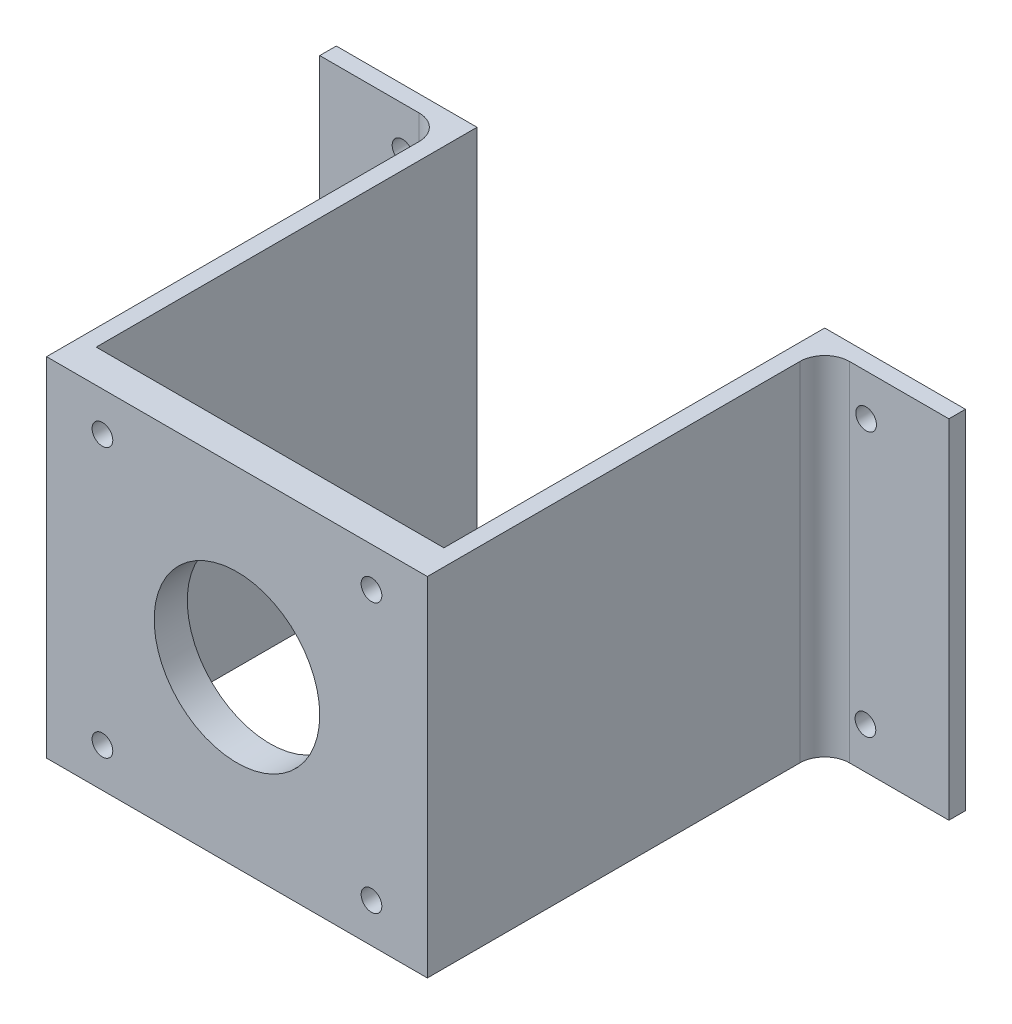
from build123d import *

# Parameters (mm, degrees)
CROQUIS1_W              = 46
CROQUIS1_H              = 42
SALIENTE_EXTRUIR1_DEPTH = 4
CROQUIS3_W              = 2
CROQUIS3_H              = 42
SALIENTE_EXTRUIR2_DEPTH = 46
CROQUIS4_W              = 2
CROQUIS4_H              = 42
SALIENTE_EXTRUIR3_DEPTH = 15
CROQUIS6_W              = 2
CROQUIS6_H              = 42
SALIENTE_EXTRUIR4_DEPTH = 15
CROQUIS8_R              = 1.25
CORTAR_EXTRUIR1_DEPTH   = 15
CROQUIS7_R              = 1.25
CORTAR_EXTRUIR2_DEPTH   = 15
CROQUIS10_R             = 1.25
CORTAR_EXTRUIR4_DEPTH   = 15
REDONDEO1_R             = 3
REDONDEO2_R             = 3
CROQUIS11_R             = 10
CORTAR_EXTRUIR5_DEPTH   = 15


with BuildPart() as part:
    # Croquis1 → Saliente-Extruir1 (new body)
    with BuildSketch(Plane.XY):
        with Locations((-61.749794594, 15.620374367)):
            Rectangle(CROQUIS1_W, CROQUIS1_H)
    extrude(amount=SALIENTE_EXTRUIR1_DEPTH)

    # Croquis3 → Saliente-Extruir2 (add)
    with BuildSketch(Plane(origin=(0, 0, 0), x_dir=(-1, 0, 0), z_dir=(0, 0, -1))):
        with Locations((83.749794594, 15.620374367)):
            Rectangle(CROQUIS3_W, CROQUIS3_H)
        with Locations((39.749794594, 15.620374367)):
            Rectangle(CROQUIS3_W, CROQUIS3_H)
    extrude(amount=SALIENTE_EXTRUIR2_DEPTH)

    # Croquis4 → Saliente-Extruir3 (add)
    with BuildSketch(Plane.ZY.offset(84.749794594)):
        with Locations((-45, 15.620374367)):
            Rectangle(CROQUIS4_W, CROQUIS4_H)
    extrude(amount=SALIENTE_EXTRUIR3_DEPTH)

    # Croquis6 → Saliente-Extruir4 (add)
    with BuildSketch(Plane(origin=(-38.749794594, 0, 0), x_dir=(0, 0, -1), z_dir=(1, 0, 0))):
        with Locations((45, 15.620374367)):
            Rectangle(CROQUIS6_W, CROQUIS6_H)
    extrude(amount=SALIENTE_EXTRUIR4_DEPTH)

    # Croquis8 → Cortar-Extruir1 (cut)
    with BuildSketch(Plane.XY.offset(4)):
        with Locations((-77.999794594, -0.629625633)):
            Circle(CROQUIS8_R)
        with Locations((-77.999794594, 31.870374367)):
            Circle(CROQUIS8_R)
        with Locations((-45.499794594, 31.870374367)):
            Circle(CROQUIS8_R)
    extrude(amount=-CORTAR_EXTRUIR1_DEPTH, mode=Mode.SUBTRACT)

    # Croquis7 → Cortar-Extruir2 (cut)
    with BuildSketch(Plane.XY.offset(4)):
        with Locations((-45.499794594, -0.629625633)):
            Circle(CROQUIS7_R)
    extrude(amount=-CORTAR_EXTRUIR2_DEPTH, mode=Mode.SUBTRACT)

    # Croquis10 → Cortar-Extruir4 (cut)
    with BuildSketch(Plane.XY.offset(-44)):
        with Locations((-33.749794594, 31.620374367)):
            Circle(CROQUIS10_R)
        with Locations((-33.829898146, -0.379625633)):
            Circle(CROQUIS10_R)
    cortar_extruir4 = extrude(amount=-CORTAR_EXTRUIR4_DEPTH, mode=Mode.SUBTRACT)

    # Simetría1: Cortar-Extruir4 across plane
    add(cortar_extruir4.mirror(Plane(origin=(-61.749794594, 0, 0), x_dir=(0, 0, 1), z_dir=(1, 0, 0))), mode=Mode.SUBTRACT)

    # Redondeo1
    redondeo1_edges = [part.edges().sort_by_distance(p)[0] for p in [
        (-84.749794594, 15.620374367, -44),
    ]]
    fillet(redondeo1_edges, radius=REDONDEO1_R)

    # Redondeo2
    redondeo2_edges = [part.edges().sort_by_distance(p)[0] for p in [
        (-38.749794594, 15.620374367, -44),
    ]]
    fillet(redondeo2_edges, radius=REDONDEO2_R)

    # Croquis11 → Cortar-Extruir5 (cut)
    with BuildSketch(Plane.XY.offset(4)):
        with Locations((-61.749794594, 15.620374367)):
            Circle(CROQUIS11_R)
    extrude(amount=-CORTAR_EXTRUIR5_DEPTH, mode=Mode.SUBTRACT)


solid = part.part
